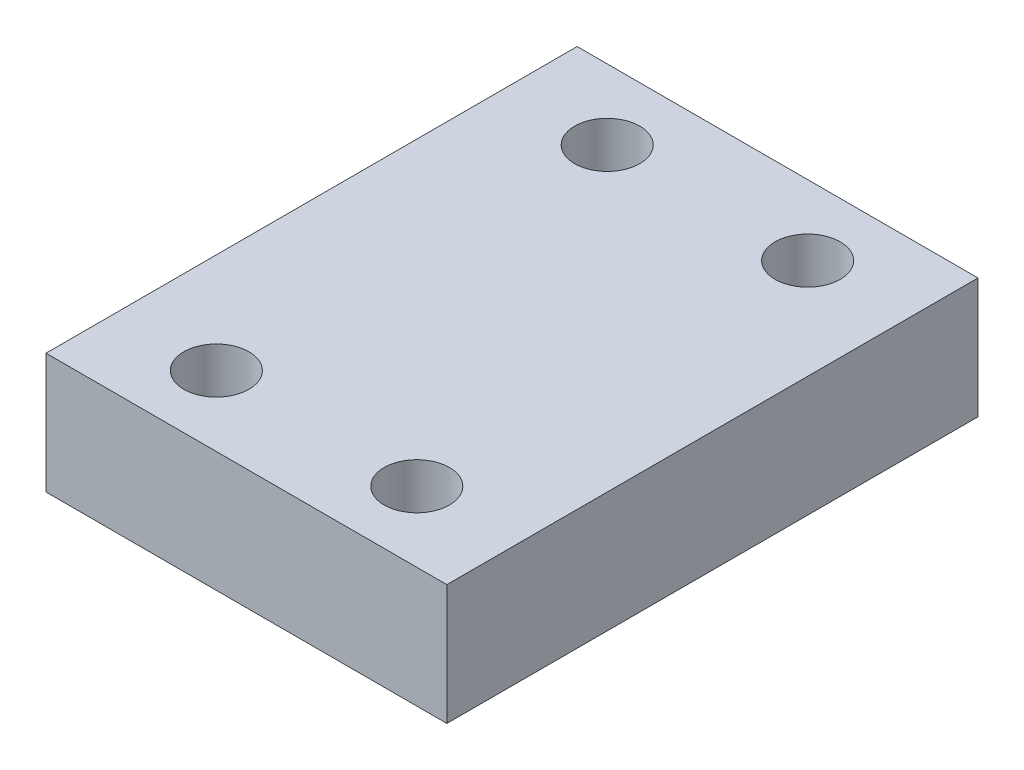
from build123d import *

# Parameters (mm, degrees)
SKETCH1_W           = 40
SKETCH1_H           = 53
BOSS_EXTRUDE1_DEPTH = 12
SKETCH2_R           = 8
CUT_EXTRUDE1_DEPTH  = 6
SKETCH4_R           = 4.25
CUT_EXTRUDE2_DEPTH  = 1.5
CUT_EXTRUDE3_REACH  = 43.884
SKETCH5_R           = 3.25


with BuildPart() as part:
    # Sketch1 → Boss-Extrude1 (new body)
    with BuildSketch(Plane(origin=(0, 0, 0), x_dir=(1, 0, 0), z_dir=(0, 1, 0))):
        with Locations((2.478549399, -6.741379093)):
            Rectangle(SKETCH1_W, SKETCH1_H)
    extrude(amount=BOSS_EXTRUDE1_DEPTH)

    # Sketch2 → Cut-Extrude1 (cut)
    with BuildSketch(Plane.XZ):
        with Locations((2.478549399, 6.741379093)):
            Circle(SKETCH2_R)
    extrude(amount=-CUT_EXTRUDE1_DEPTH, mode=Mode.SUBTRACT)

    # Sketch4 → Cut-Extrude2 (cut)
    with BuildSketch(Plane.XZ.offset(-6)):
        with Locations((2.478549399, 6.741379093)):
            Circle(SKETCH4_R)
    extrude(amount=-CUT_EXTRUDE2_DEPTH, mode=Mode.SUBTRACT)

    # Sketch5 → Cut-Extrude3 (cut, up to next)
    with BuildSketch(Plane(origin=(0, 12, 0), x_dir=(1, 0, 0), z_dir=(0, 1, 0)), mode=Mode.PRIVATE) as cut_extrude3_sk1:
        with Locations((-7.521450601, -26.241379093)):
            Circle(SKETCH5_R)
    cut_extrude3_tool1 = extrude(cut_extrude3_sk1.sketch, amount=-CUT_EXTRUDE3_REACH, mode=Mode.PRIVATE) & part.part
    # Sketch5 → Cut-Extrude3 (cut, up to next)
    with BuildSketch(Plane(origin=(0, 12, 0), x_dir=(1, 0, 0), z_dir=(0, 1, 0)), mode=Mode.PRIVATE) as cut_extrude3_sk2:
        with Locations((12.478549399, -26.241379093)):
            Circle(SKETCH5_R)
    cut_extrude3_tool2 = extrude(cut_extrude3_sk2.sketch, amount=-CUT_EXTRUDE3_REACH, mode=Mode.PRIVATE) & part.part
    # Sketch5 → Cut-Extrude3 (cut, up to next)
    with BuildSketch(Plane(origin=(0, 12, 0), x_dir=(1, 0, 0), z_dir=(0, 1, 0)), mode=Mode.PRIVATE) as cut_extrude3_sk3:
        with Locations((-7.521450601, 12.758620907)):
            Circle(SKETCH5_R)
    cut_extrude3_tool3 = extrude(cut_extrude3_sk3.sketch, amount=-CUT_EXTRUDE3_REACH, mode=Mode.PRIVATE) & part.part
    # Sketch5 → Cut-Extrude3 (cut, up to next)
    with BuildSketch(Plane(origin=(0, 12, 0), x_dir=(1, 0, 0), z_dir=(0, 1, 0)), mode=Mode.PRIVATE) as cut_extrude3_sk4:
        with Locations((12.478549399, 12.758620907)):
            Circle(SKETCH5_R)
    cut_extrude3_tool4 = extrude(cut_extrude3_sk4.sketch, amount=-CUT_EXTRUDE3_REACH, mode=Mode.PRIVATE) & part.part
    add(cut_extrude3_tool1.solids().sort_by_distance((-7.521451, 12, 26.241379))[0], mode=Mode.SUBTRACT)
    add(cut_extrude3_tool2.solids().sort_by_distance((12.478549, 12, 26.241379))[0], mode=Mode.SUBTRACT)
    add(cut_extrude3_tool3.solids().sort_by_distance((-7.521451, 12, -12.758621))[0], mode=Mode.SUBTRACT)
    add(cut_extrude3_tool4.solids().sort_by_distance((12.478549, 12, -12.758621))[0], mode=Mode.SUBTRACT)


solid = part.part
